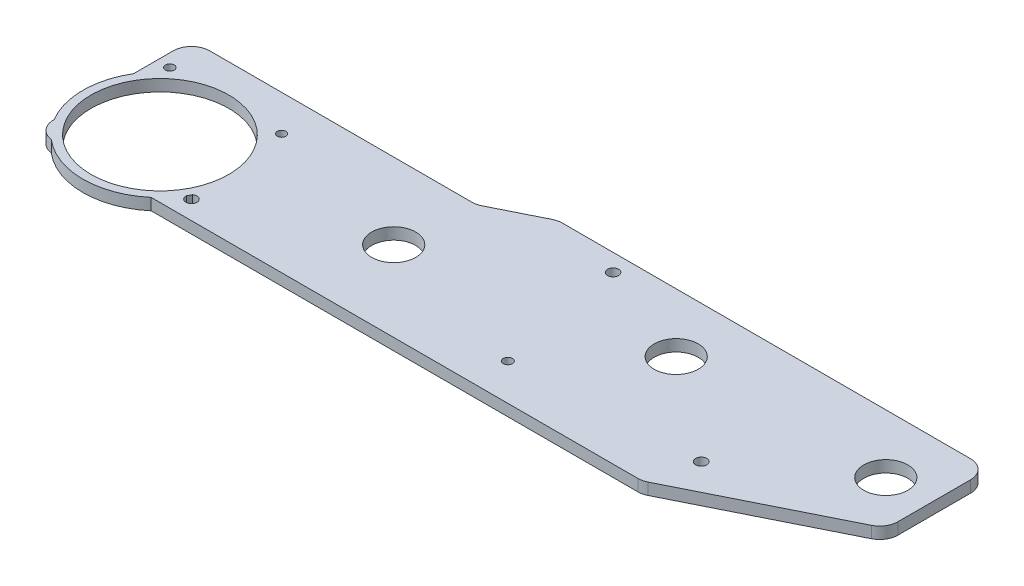
from build123d import *

# Parameters (mm, degrees)
SKETCH1_W           = 210
SKETCH1_H           = 50
SKETCH1_R           = 1.211665018
SKETCH1_R_2         = 1.165617118
SKETCH1_R_3         = 1.5
SKETCH1_R_4         = 1.25
SKETCH1_R_5         = 1.517273905
BOSS_EXTRUDE1_DEPTH = 3.175
SKETCH2_R           = 2
CUT_EXTRUDE1_DEPTH  = 10
SKETCH3_R           = 6
SKETCH3_R_2         = 0.586995366
CUT_EXTRUDE2_DEPTH  = 57.15
CUT_EXTRUDE7_DEPTH  = 10
FILLET3_R           = 5
SKETCH11_R          = 21
SKETCH11_R_2        = 2
BOSS_EXTRUDE4_DEPTH = 3.175
SKETCH12_R          = 18.78
CUT_EXTRUDE8_DEPTH  = 10


with BuildPart() as part:
    # Sketch1 → Boss-Extrude1 (new body)
    with BuildSketch(Plane(origin=(0, 0, 0), x_dir=(1, 0, 0), z_dir=(0, 1, 0))):
        with Locations((105, -25)):
            Rectangle(SKETCH1_W, SKETCH1_H)
        with Locations((3.489526233, -16.787661112)):
            Circle(SKETCH1_R, mode=Mode.SUBTRACT)
        with Locations((34.37258772, -17.194005245)):
            Circle(SKETCH1_R_2, mode=Mode.SUBTRACT)
        with Locations((37.520749958, -44.921198121)):
            Circle(SKETCH1_R_3, mode=Mode.SUBTRACT)
        with Locations((118.879039361, -40.017685043)):
            Circle(SKETCH1_R_4, mode=Mode.SUBTRACT)
        with Locations((112.302052499, -4.739260115)):
            Circle(SKETCH1_R_3, mode=Mode.SUBTRACT)
        with Locations((168.975233936, -37.403209633)):
            Circle(SKETCH1_R_5, mode=Mode.SUBTRACT)
    extrude(amount=BOSS_EXTRUDE1_DEPTH)

    # Sketch2 → Cut-Extrude1 (cut)
    with BuildSketch(Plane(origin=(0, 3.175, 0), x_dir=(1, 0, 0), z_dir=(0, 1, 0))):
        with Locations((10, -26)):
            Circle(SKETCH2_R)
        with Locations((10, -42)):
            Circle(SKETCH2_R)
        with Locations((26, -26)):
            Circle(SKETCH2_R)
        with Locations((26, -42)):
            Circle(SKETCH2_R)
    extrude(amount=-CUT_EXTRUDE1_DEPTH, mode=Mode.SUBTRACT)

    # Sketch3 → Cut-Extrude2 (cut)
    with BuildSketch(Plane(origin=(0, 3.175, 0), x_dir=(1, 0, 0), z_dir=(0, 1, 0))):
        with Locations((75.84991357, -28.1)):
            Circle(SKETCH3_R)
        with Locations((140.771956051, -16)):
            Circle(SKETCH3_R)
        with Locations((18, -34)):
            Circle(SKETCH3_R_2)
        with Locations((197.921956051, -16)):
            Circle(SKETCH3_R)
    extrude(amount=-CUT_EXTRUDE2_DEPTH, mode=Mode.SUBTRACT)

    # Sketch10 → Cut-Extrude7 (cut)
    with BuildSketch(Plane(origin=(0, 3.175, 0), x_dir=(1, 0, 0), z_dir=(0, 1, 0))):
        Polygon((210, -27.859435908), (165.502877994, -50), (210, -50), align=None)
        Polygon((92.532613397, 0), (77.65477062, -7.402812063), (0, -7.402812063), (0, 0), align=None)
    extrude(amount=-CUT_EXTRUDE7_DEPTH, mode=Mode.SUBTRACT)

    # Fillet3
    fillet3_edges = [part.edges().sort_by_distance(p)[0] for p in [
        (0, 1.5875, 50),
        (0, 1.5875, 7.402812063),
        (77.65477062, 1.5875, 7.402812063),
        (92.532613397, 1.5875, 0),
        (210, 1.5875, 0),
        (210, 1.5875, 27.859435908),
        (165.502877994, 1.5875, 50),
    ]]
    fillet(fillet3_edges, radius=FILLET3_R)

    # Sketch11 → Boss-Extrude4 (add)
    with BuildSketch(Plane(origin=(0, 3.175, 0), x_dir=(1, 0, 0), z_dir=(0, 1, 0))):
        with Locations((18, -34)):
            Circle(SKETCH11_R)
        with Locations((10, -26)):
            Circle(SKETCH11_R_2, mode=Mode.SUBTRACT)
        with Locations((10, -42)):
            Circle(SKETCH11_R_2, mode=Mode.SUBTRACT)
        with Locations((26, -26)):
            Circle(SKETCH11_R_2, mode=Mode.SUBTRACT)
        with Locations((26, -42)):
            Circle(SKETCH11_R_2, mode=Mode.SUBTRACT)
    extrude(amount=-BOSS_EXTRUDE4_DEPTH)

    # Sketch12 → Cut-Extrude8 (cut)
    with BuildSketch(Plane(origin=(0, 3.175, 0), x_dir=(1, 0, 0), z_dir=(0, 1, 0))):
        with Locations((18, -34)):
            Circle(SKETCH12_R)
    extrude(amount=-CUT_EXTRUDE8_DEPTH, mode=Mode.SUBTRACT)


solid = part.part
